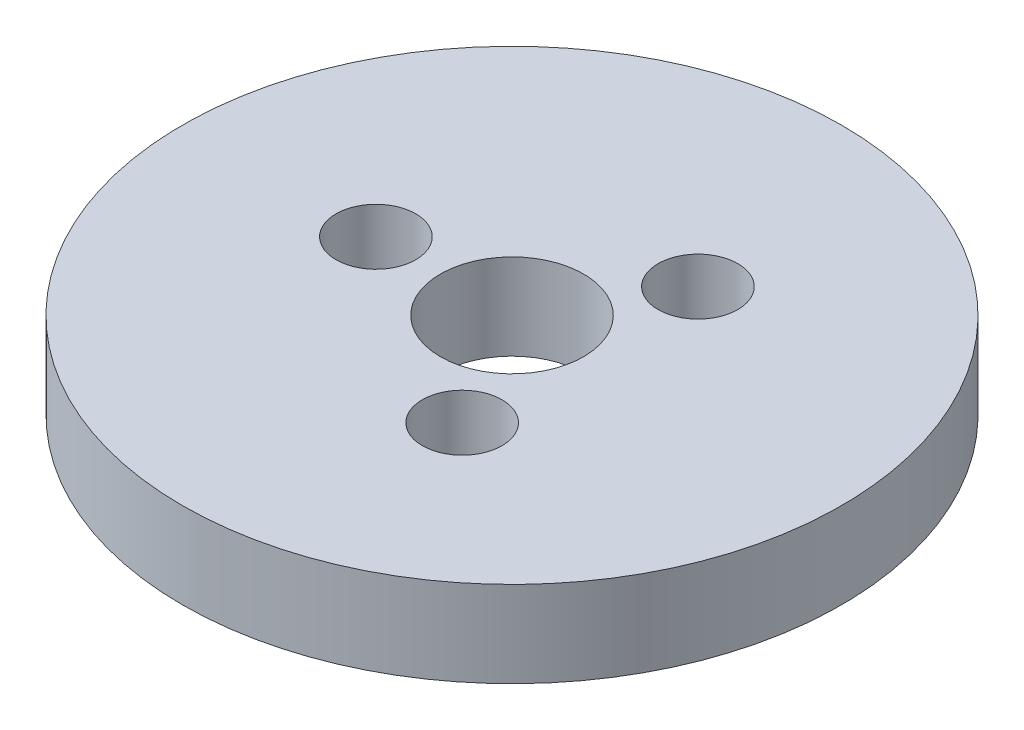
from build123d import *

# Parameters (mm, degrees)
SKETCH1_R           = 57.5
BOSS_EXTRUDE1_DEPTH = 15
SKETCH2_R           = 12.5
CUT_EXTRUDE1_DEPTH  = 83.689177043
SKETCH3_R           = 6.951881644
CUT_EXTRUDE2_DEPTH  = 10.886511335
CIRPATTERN1_COUNT   = 3


with BuildPart() as part:
    # Sketch1 → Boss-Extrude1 (new body)
    with BuildSketch(Plane(origin=(0, 0, 0), x_dir=(1, 0, 0), z_dir=(0, 1, 0))):
        Circle(SKETCH1_R)
    extrude(amount=BOSS_EXTRUDE1_DEPTH)

    # Sketch2 → Cut-Extrude1 (cut, through all)
    with BuildSketch(Plane(origin=(0, 0, 0), x_dir=(1, 0, 0), z_dir=(0, 1, 0))):
        Circle(SKETCH2_R)
    extrude(amount=CUT_EXTRUDE1_DEPTH, mode=Mode.SUBTRACT)

    # Sketch3 → Cut-Extrude2 (cut)
    with BuildSketch(Plane(origin=(0, 15, 0), x_dir=(1, 0, 0), z_dir=(0, 1, 0))):
        with Locations((-23.747567315, 0)):
            Circle(SKETCH3_R)
    cut_extrude2 = extrude(amount=-CUT_EXTRUDE2_DEPTH, mode=Mode.SUBTRACT)

    # CirPattern1: Cut-Extrude2 ×3 about axis
    cirpattern1_axis = Axis((0, 0, 0), (0, 1, 0))
    for i in range(1, CIRPATTERN1_COUNT):
        add(cut_extrude2.rotate(cirpattern1_axis, i * 360 / CIRPATTERN1_COUNT), mode=Mode.SUBTRACT)


solid = part.part
